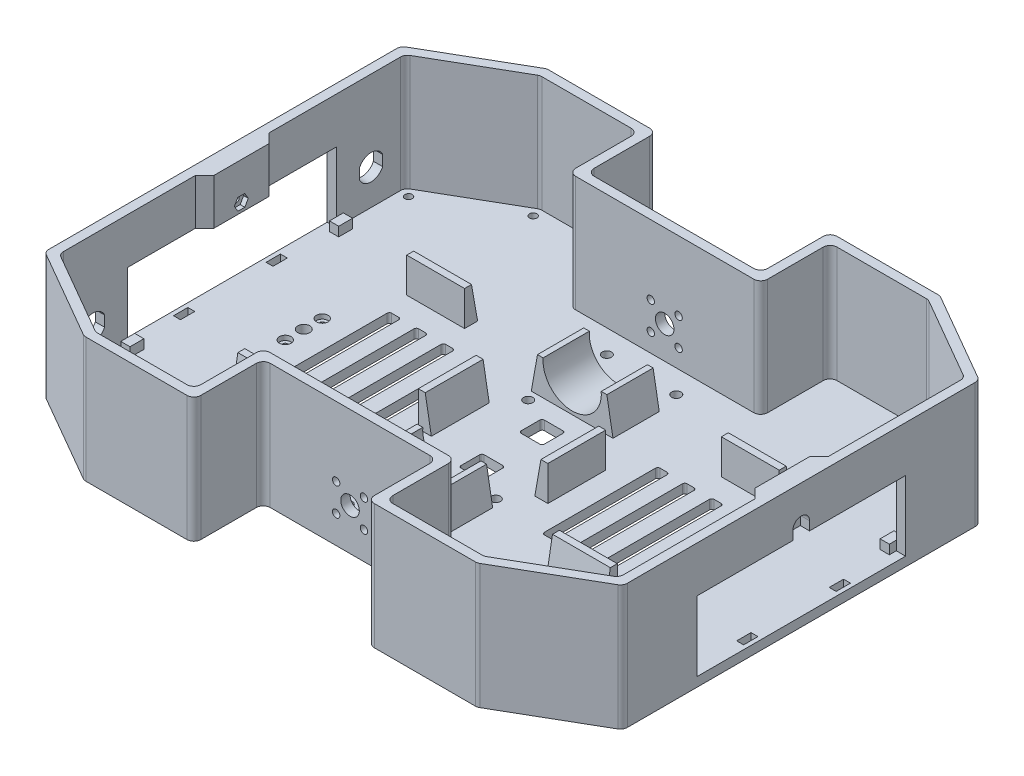
from build123d import *
from OCP.BRepFilletAPI import BRepFilletAPI_MakeChamfer

# Parameters (mm, degrees)
BOSS_EXTRUDE1_DEPTH        = 54
SHELL1_T                   = -4
CUT_EXTRUDE4_REACH         = 170.941
SKETCH7_W                  = 75
SKETCH7_H                  = 30
BOSS_EXTRUDE3_DEPTH        = 50
SKETCH9_R                  = 4
SKETCH9_R_2                = 1.6
CUT_EXTRUDE5_DEPTH         = 4
SKETCH10_W                 = 30
SKETCH10_H                 = 20
BOSS_EXTRUDE4_DEPTH        = 15
SKETCH11_R                 = 12.6
CUT_EXTRUDE6_DEPTH         = 20
SKETCH12_W                 = 10
SKETCH12_H                 = 10
CUT_EXTRUDE7_DEPTH         = 168.705098312
FILLET1_R                  = 1
CHAMFER1_SIZE              = 2.644904711
CHAMFER1_SIZE_2            = 15
CUT_EXTRUDE22_REACH        = 169.705
SKETCH36_R                 = 2
FILLET1_OF_MIRROR2_R       = 1
CHAMFER1_OF_MIRROR2_SIZE   = 2.644904711
CHAMFER1_OF_MIRROR2_SIZE_2 = 15
SKETCH13_R                 = 2.6
SKETCH13_R_2               = 1.1
CUT_EXTRUDE8_DEPTH         = 10
SKETCH14_R                 = 2.5
CUT_EXTRUDE9_DEPTH         = 2
SKETCH16_W                 = 90.2
SKETCH16_H                 = 30.2
CUT_EXTRUDE10_DEPTH        = 4.2
CUT_EXTRUDE12_REACH        = 169.705
SKETCH19_W                 = 3
SKETCH19_H                 = 6.2
CUT_EXTRUDE17_REACH        = 276.62
SKETCH27_W                 = 19.8
SKETCH27_H                 = 19.8
BOSS_EXTRUDE6_DEPTH        = 4
CUT_EXTRUDE18_DEPTH        = 2
CUT_EXTRUDE19_REACH        = 272.983
SKETCH29_R                 = 1.1
SKETCH30_W                 = 4
SKETCH30_H                 = 6
BOSS_EXTRUDE7_DEPTH        = 4
CHAMFER3_SIZE              = 6
SKETCH33_W                 = 3
SKETCH33_H                 = 25
SKETCH33_W_2               = 25
SKETCH33_H_2               = 3
BOSS_EXTRUDE9_DEPTH        = 15
CHAMFER8_SIZE              = 2.644904711
CHAMFER8_SIZE_2            = 15
CUT_EXTRUDE21_REACH        = 276.62
FILLET2_R                  = 3
FILLET3_R                  = 3
SKETCH37_R                 = 1.6
CUT_EXTRUDE23_DEPTH        = 168.705098312
CUT_EXTRUDE24_DEPTH        = 168.705098312


# Some blends are built 0.0001 mm under size
with BuildPart() as part:
    # Sketch1 → Boss-Extrude1 (new body)
    with BuildSketch(Plane(origin=(0, 0, 0), x_dir=(1, 0, 0), z_dir=(0, 1, 0))):
        Polygon((-85, 100), (85, 100), (125, 76.905989232), (125, -76.905989232), (85, -100), (-85, -100), (-125, -76.905989232), (-125, 76.905989232), align=None)
    extrude(amount=BOSS_EXTRUDE1_DEPTH)

    # Shell1
    shell1_openings = [part.faces().sort_by_distance(p)[0] for p in [
        (0, 54, 0),
    ]]
    offset(amount=SHELL1_T, openings=shell1_openings, kind=Kind.INTERSECTION)

    # Sketch7 → Cut-Extrude4 (cut, up to next)
    with BuildSketch(Plane(origin=(0, 54, 0), x_dir=(1, 0, 0), z_dir=(0, 1, 0)), mode=Mode.PRIVATE) as cut_extrude4_sk1:
        with Locations((0, -85)):
            Rectangle(SKETCH7_W, SKETCH7_H)
    cut_extrude4_tool1 = extrude(cut_extrude4_sk1.sketch, amount=-CUT_EXTRUDE4_REACH, mode=Mode.PRIVATE) & part.part
    cut_extrude4 = cut_extrude4_tool1.solids().sort_by_distance((0, 54, 85))[0]
    add(cut_extrude4, mode=Mode.SUBTRACT)

    # Sketch8 → Boss-Extrude3 (add)
    with BuildSketch(Plane(origin=(0, 4, 0), x_dir=(1, 0, 0), z_dir=(0, 1, 0))):
        Polygon((-37.5, -96), (-37.5, -70), (37.5, -70), (37.5, -96), (41.5, -96), (41.5, -66), (-41.5, -66), (-41.5, -96), align=None)
    boss_extrude3 = extrude(amount=BOSS_EXTRUDE3_DEPTH)

    # Sketch9 → Cut-Extrude5 (cut)
    with BuildSketch(Plane.XY.offset(70)):
        with Locations((0, 18)):
            Circle(SKETCH9_R)
        with Locations((-6.01040764, 11.98959236)):
            Circle(SKETCH9_R_2)
        with Locations((-6.01040764, 24.01040764)):
            Circle(SKETCH9_R_2)
        with Locations((6.01040764, 24.01040764)):
            Circle(SKETCH9_R_2)
        with Locations((6.01040764, 11.98959236)):
            Circle(SKETCH9_R_2)
    cut_extrude5 = extrude(amount=-CUT_EXTRUDE5_DEPTH, mode=Mode.SUBTRACT)

    # Sketch10 → Boss-Extrude4 (add)
    with BuildSketch(Plane(origin=(0, 4, 0), x_dir=(1, 0, 0), z_dir=(0, 1, 0))):
        with Locations((0, -36)):
            Rectangle(SKETCH10_W, SKETCH10_H)
    boss_extrude4 = extrude(amount=BOSS_EXTRUDE4_DEPTH)

    # Sketch11 → Cut-Extrude6 (cut)
    with BuildSketch(Plane.XY.offset(46)):
        with Locations((0, 18)):
            Circle(SKETCH11_R)
    cut_extrude6 = extrude(amount=-CUT_EXTRUDE6_DEPTH, mode=Mode.SUBTRACT)

    # Sketch12 → Cut-Extrude7 (cut, through all)
    with BuildSketch(Plane(origin=(0, 4, 0), x_dir=(1, 0, 0), z_dir=(0, 1, 0))):
        with Locations((0, -13)):
            Rectangle(SKETCH12_W, SKETCH12_H)
    cut_extrude7 = extrude(amount=-CUT_EXTRUDE7_DEPTH, mode=Mode.SUBTRACT)

    # Fillet1
    fillet1_edges = [part.edges().sort_by_distance(p)[0] for p in [
        (-5, 2, 18),
        (-5, 2, 8),
        (5, 2, 8),
        (5, 2, 18),
    ]]
    fillet(fillet1_edges, radius=FILLET1_R)

    # Chamfer1
    chamfer1_edges_1 = [part.edges().sort_by_distance(p)[0] for p in [
        (-15, 4, 36),
    ]]
    chamfer1_side_1 = [part.faces().sort_by_distance(p)[0] for p in [
        (-15.052898094, 4, 36),
    ]]
    chamfer1_edges_2 = [part.edges().sort_by_distance(p)[0] for p in [
        (15, 4, 36),
    ]]
    chamfer1_side_2 = [part.faces().sort_by_distance(p)[0] for p in [
        (15.052898094, 4, 36),
    ]]
    chamfer1 = BRepFilletAPI_MakeChamfer(part.part.solid().wrapped)
    for e in chamfer1_edges_1:
        chamfer1.Add(CHAMFER1_SIZE - 0.0001, CHAMFER1_SIZE_2 - 0.0001, e.wrapped, chamfer1_side_1[0].wrapped)
    for e in chamfer1_edges_2:
        chamfer1.Add(CHAMFER1_SIZE - 0.0001, CHAMFER1_SIZE_2 - 0.0001, e.wrapped, chamfer1_side_2[0].wrapped)
    add(Compound.cast(chamfer1.Shape()), mode=Mode.REPLACE)  # a hair under: the kernel refuses the full size

    # Sketch36 → Cut-Extrude22 (cut, up to next)
    with BuildSketch(Plane(origin=(0, 4, 0), x_dir=(1, 0, 0), z_dir=(0, 1, 0)), mode=Mode.PRIVATE) as cut_extrude22_sk1:
        with Locations(Location((15, -56, 0), (0, 0, 270))):
            Circle(SKETCH36_R)
    cut_extrude22_tool1 = extrude(cut_extrude22_sk1.sketch, amount=-CUT_EXTRUDE22_REACH, mode=Mode.PRIVATE) & part.part
    # Sketch36 → Cut-Extrude22 (cut, up to next)
    with BuildSketch(Plane(origin=(0, 4, 0), x_dir=(1, 0, 0), z_dir=(0, 1, 0)), mode=Mode.PRIVATE) as cut_extrude22_sk2:
        with Locations(Location((-15, -56, 0), (0, 0, 270))):
            Circle(SKETCH36_R)
    cut_extrude22_tool2 = extrude(cut_extrude22_sk2.sketch, amount=-CUT_EXTRUDE22_REACH, mode=Mode.PRIVATE) & part.part
    # Sketch36 → Cut-Extrude22 (cut, up to next)
    with BuildSketch(Plane(origin=(0, 4, 0), x_dir=(1, 0, 0), z_dir=(0, 1, 0)), mode=Mode.PRIVATE) as cut_extrude22_sk3:
        with Locations(Location((-15, -22, 0), (0, 0, 270))):
            Circle(SKETCH36_R)
    cut_extrude22_tool3 = extrude(cut_extrude22_sk3.sketch, amount=-CUT_EXTRUDE22_REACH, mode=Mode.PRIVATE) & part.part
    # Sketch36 → Cut-Extrude22 (cut, up to next)
    with BuildSketch(Plane(origin=(0, 4, 0), x_dir=(1, 0, 0), z_dir=(0, 1, 0)), mode=Mode.PRIVATE) as cut_extrude22_sk4:
        with Locations(Location((15, -22, 0), (0, 0, 270))):
            Circle(SKETCH36_R)
    cut_extrude22_tool4 = extrude(cut_extrude22_sk4.sketch, amount=-CUT_EXTRUDE22_REACH, mode=Mode.PRIVATE) & part.part
    cut_extrude22_1 = cut_extrude22_tool1.solids().sort_by_distance((15, 4, 56))[0]
    add(cut_extrude22_1, mode=Mode.SUBTRACT)
    cut_extrude22_2 = cut_extrude22_tool2.solids().sort_by_distance((-15, 4, 56))[0]
    add(cut_extrude22_2, mode=Mode.SUBTRACT)
    cut_extrude22_3 = cut_extrude22_tool3.solids().sort_by_distance((-15, 4, 22))[0]
    add(cut_extrude22_3, mode=Mode.SUBTRACT)
    cut_extrude22_4 = cut_extrude22_tool4.solids().sort_by_distance((15, 4, 22))[0]
    add(cut_extrude22_4, mode=Mode.SUBTRACT)
    cut_extrude22 = cut_extrude22_1 + cut_extrude22_2 + cut_extrude22_3 + cut_extrude22_4  # Cut-Extrude22 as one shape, for the pattern or mirror that repeats it

    # Mirror2: Cut-Extrude4, Boss-Extrude3, Cut-Extrude5, Boss-Extrude4, Cut-Extrude6, Cut-Extrude7, Cut-Extrude22 across plane
    add(cut_extrude4.mirror(Plane.XY), mode=Mode.SUBTRACT)
    add(boss_extrude3.mirror(Plane.XY))
    add(cut_extrude5.mirror(Plane.XY), mode=Mode.SUBTRACT)
    add(boss_extrude4.mirror(Plane.XY))
    add(cut_extrude6.mirror(Plane.XY), mode=Mode.SUBTRACT)
    add(cut_extrude7.mirror(Plane.XY), mode=Mode.SUBTRACT)
    add(cut_extrude22.mirror(Plane.XY), mode=Mode.SUBTRACT)

    # Fillet1 of Mirror2
    fillet1_of_mirror2_edges = [part.edges().sort_by_distance(p)[0] for p in [
        (-5, 2, -18),
        (-5, 2, -8),
        (5, 2, -8),
        (5, 2, -18),
    ]]
    fillet(fillet1_of_mirror2_edges, radius=FILLET1_OF_MIRROR2_R)

    # Chamfer1 of Mirror2
    chamfer1_of_mirror2_edges_1 = [part.edges().sort_by_distance(p)[0] for p in [
        (-15, 4, -36),
    ]]
    chamfer1_of_mirror2_side_1 = [part.faces().sort_by_distance(p)[0] for p in [
        (-15.052898094, 4, -36),
    ]]
    chamfer1_of_mirror2_edges_2 = [part.edges().sort_by_distance(p)[0] for p in [
        (15, 4, -36),
    ]]
    chamfer1_of_mirror2_side_2 = [part.faces().sort_by_distance(p)[0] for p in [
        (15.052898094, 4, -36),
    ]]
    chamfer1_of_mirror2 = BRepFilletAPI_MakeChamfer(part.part.solid().wrapped)
    for e in chamfer1_of_mirror2_edges_1:
        chamfer1_of_mirror2.Add(CHAMFER1_OF_MIRROR2_SIZE - 0.0001, CHAMFER1_OF_MIRROR2_SIZE_2 - 0.0001, e.wrapped, chamfer1_of_mirror2_side_1[0].wrapped)
    for e in chamfer1_of_mirror2_edges_2:
        chamfer1_of_mirror2.Add(CHAMFER1_OF_MIRROR2_SIZE - 0.0001, CHAMFER1_OF_MIRROR2_SIZE_2 - 0.0001, e.wrapped, chamfer1_of_mirror2_side_2[0].wrapped)
    add(Compound.cast(chamfer1_of_mirror2.Shape()), mode=Mode.REPLACE)  # a hair under: the kernel refuses the full size

    # Sketch13 → Cut-Extrude8 (cut)
    with BuildSketch(Plane(origin=(0, 4, 0), x_dir=(1, 0, 0), z_dir=(0, 1, 0))):
        with Locations(Location((-90, 0, 0), (0, 0, 270))):
            Circle(SKETCH13_R)
        with Locations(Location((90, 0, 0), (0, 0, 270))):
            Circle(SKETCH13_R)
        with Locations(Location((-90.000478025, -7.999999986, 0), (0, 0, 270))):
            Circle(SKETCH13_R_2)
        with Locations(Location((-89.999521975, 7.999999986, 0), (0, 0, 270))):
            Circle(SKETCH13_R_2)
        with Locations(Location((89.999521975, -7.999999986, 0), (0, 0, 270))):
            Circle(SKETCH13_R_2)
        with Locations(Location((90.000478025, 7.999999986, 0), (0, 0, 270))):
            Circle(SKETCH13_R_2)
    extrude(amount=-CUT_EXTRUDE8_DEPTH, mode=Mode.SUBTRACT)

    # Sketch14 → Cut-Extrude9 (cut)
    with BuildSketch(Plane(origin=(0, 4, 0), x_dir=(1, 0, 0), z_dir=(0, 1, 0))):
        with Locations(Location((-89.999521975, 7.999999986, 0), (0, 0, 270))):
            Circle(SKETCH14_R)
        with Locations(Location((-90.000478025, -7.999999986, 0), (0, 0, 270))):
            Circle(SKETCH14_R)
        with Locations(Location((90.000478025, 7.999999986, 0), (0, 0, 270))):
            Circle(SKETCH14_R)
        with Locations(Location((89.999521975, -7.999999986, 0), (0, 0, 270))):
            Circle(SKETCH14_R)
    extrude(amount=-CUT_EXTRUDE9_DEPTH, mode=Mode.SUBTRACT)

    # Sketch16 → Cut-Extrude10 (cut)
    with BuildSketch(Plane.ZY.offset(125)):
        with Locations((0, 19.1)):
            Rectangle(SKETCH16_W, SKETCH16_H)
    cut_extrude10 = extrude(amount=-CUT_EXTRUDE10_DEPTH, mode=Mode.SUBTRACT)

    # Sketch19 → Cut-Extrude12 (cut, up to next)
    with BuildSketch(Plane(origin=(0, 4, 0), x_dir=(1, 0, 0), z_dir=(0, 1, 0)), mode=Mode.PRIVATE) as cut_extrude12_sk1:
        with Locations((-121.7, 20)):
            Rectangle(SKETCH19_W, SKETCH19_H)
    cut_extrude12_tool1 = extrude(cut_extrude12_sk1.sketch, amount=-CUT_EXTRUDE12_REACH, mode=Mode.PRIVATE) & part.part
    # Sketch19 → Cut-Extrude12 (cut, up to next)
    with BuildSketch(Plane(origin=(0, 4, 0), x_dir=(1, 0, 0), z_dir=(0, 1, 0)), mode=Mode.PRIVATE) as cut_extrude12_sk2:
        with Locations((-121.7, -20)):
            Rectangle(SKETCH19_W, SKETCH19_H)
    cut_extrude12_tool2 = extrude(cut_extrude12_sk2.sketch, amount=-CUT_EXTRUDE12_REACH, mode=Mode.PRIVATE) & part.part
    cut_extrude12_1 = cut_extrude12_tool1.solids().sort_by_distance((-121.7, 4, -20))[0]
    add(cut_extrude12_1, mode=Mode.SUBTRACT)
    cut_extrude12_2 = cut_extrude12_tool2.solids().sort_by_distance((-121.7, 4, 20))[0]
    add(cut_extrude12_2, mode=Mode.SUBTRACT)
    cut_extrude12 = cut_extrude12_1 + cut_extrude12_2  # Cut-Extrude12 as one shape, for the pattern or mirror that repeats it

    # Sketch26 → Cut-Extrude17 (cut, up to next)
    with BuildSketch(Plane.ZY.offset(125), mode=Mode.PRIVATE) as cut_extrude17_sk1:
        with BuildLine():
            ThreePointArc((3.6, 38), (0, 41.6), (-3.6, 38))
            Line((-3.6, 38), (3.6, 38))
        make_face()
    cut_extrude17_tool1 = extrude(cut_extrude17_sk1.sketch, amount=-CUT_EXTRUDE17_REACH, mode=Mode.PRIVATE) & part.part
    # Sketch26 → Cut-Extrude17 (cut, up to next)
    with BuildSketch(Plane.ZY.offset(125), mode=Mode.PRIVATE) as cut_extrude17_sk2:
        with BuildLine():
            Line((3.6, 38), (-3.6, 38))
            ThreePointArc((-3.6, 38), (0, 34.4), (3.6, 38))
        make_face()
    cut_extrude17_tool2 = extrude(cut_extrude17_sk2.sketch, amount=-CUT_EXTRUDE17_REACH, mode=Mode.PRIVATE) & part.part
    # Sketch26 → Cut-Extrude17 (cut, up to next)
    with BuildSketch(Plane.ZY.offset(125), mode=Mode.PRIVATE) as cut_extrude17_sk3:
        with BuildLine():
            ThreePointArc((3.6, 38), (0, 41.6), (-3.6, 38))
            Line((-3.6, 38), (3.6, 38))
        make_face()
    cut_extrude17_tool3 = extrude(cut_extrude17_sk3.sketch, amount=-CUT_EXTRUDE17_REACH, mode=Mode.PRIVATE) & part.part
    # Sketch26 → Cut-Extrude17 (cut, up to next)
    with BuildSketch(Plane.ZY.offset(125), mode=Mode.PRIVATE) as cut_extrude17_sk4:
        with BuildLine():
            Line((3.6, 38), (-3.6, 38))
            ThreePointArc((-3.6, 38), (0, 34.4), (3.6, 38))
        make_face()
    cut_extrude17_tool4 = extrude(cut_extrude17_sk4.sketch, amount=-CUT_EXTRUDE17_REACH, mode=Mode.PRIVATE) & part.part
    # Sketch26 → Cut-Extrude17 (cut, up to next)
    with BuildSketch(Plane.ZY.offset(125), mode=Mode.PRIVATE) as cut_extrude17_sk5:
        with BuildLine():
            ThreePointArc((3.6, 38), (0, 34.4), (-3.6, 38))
            Line((-3.6, 38), (-3.6, 34.2))
            Line((-3.6, 34.2), (3.6, 34.2))
            Line((3.6, 34.2), (3.6, 38))
        make_face()
    cut_extrude17_tool5 = extrude(cut_extrude17_sk5.sketch, amount=-CUT_EXTRUDE17_REACH, mode=Mode.PRIVATE) & part.part
    cut_extrude17_1 = cut_extrude17_tool1.solids().sort_by_distance((-125, 39.527887, 0))[0]
    add(cut_extrude17_1, mode=Mode.SUBTRACT)
    cut_extrude17_2 = cut_extrude17_tool2.solids().sort_by_distance((-125, 36.472113, 0))[0]
    add(cut_extrude17_2, mode=Mode.SUBTRACT)
    cut_extrude17_3 = cut_extrude17_tool3.solids().sort_by_distance((-125, 39.527887, 0))[0]
    add(cut_extrude17_3, mode=Mode.SUBTRACT)
    cut_extrude17_4 = cut_extrude17_tool4.solids().sort_by_distance((-125, 36.472113, 0))[0]
    add(cut_extrude17_4, mode=Mode.SUBTRACT)
    cut_extrude17_5 = cut_extrude17_tool5.solids().sort_by_distance((-125, 34.318587, 0))[0]
    add(cut_extrude17_5, mode=Mode.SUBTRACT)
    cut_extrude17 = cut_extrude17_1 + cut_extrude17_2 + cut_extrude17_3 + cut_extrude17_4 + cut_extrude17_5  # Cut-Extrude17 as one shape, for the pattern or mirror that repeats it

    # Sketch27 → Boss-Extrude6 (add)
    with BuildSketch(Plane(origin=(-121, 0, 0), x_dir=(0, 0, -1), z_dir=(1, 0, 0))):
        with Locations((0, 44.1)):
            Rectangle(SKETCH27_W, SKETCH27_H)
    boss_extrude6 = extrude(amount=BOSS_EXTRUDE6_DEPTH)

    # Sketch28 → Cut-Extrude18 (cut)
    with BuildSketch(Plane(origin=(-117, 0, 0), x_dir=(0, 0, -1), z_dir=(1, 0, 0))):
        Polygon((1.5011107, 35.4), (3.0022214, 38), (1.5011107, 40.6), (-1.5011107, 40.6), (-3.0022214, 38), (-1.5011107, 35.4), align=None)
    cut_extrude18 = extrude(amount=-CUT_EXTRUDE18_DEPTH, mode=Mode.SUBTRACT)

    # Sketch29 → Cut-Extrude19 (cut, up to next)
    with BuildSketch(Plane.ZY.offset(121), mode=Mode.PRIVATE) as cut_extrude19_sk1:
        with Locations((0, 38)):
            Circle(SKETCH29_R)
    cut_extrude19_tool1 = extrude(cut_extrude19_sk1.sketch, amount=-CUT_EXTRUDE19_REACH, mode=Mode.PRIVATE) & part.part
    cut_extrude19 = cut_extrude19_tool1.solids().sort_by_distance((-121, 38, 0))[0]
    add(cut_extrude19, mode=Mode.SUBTRACT)

    # Sketch30 → Boss-Extrude7 (add)
    with BuildSketch(Plane(origin=(0, 4, 0), x_dir=(1, 0, 0), z_dir=(0, 1, 0))):
        with Locations((-119, 45.1)):
            Rectangle(SKETCH30_W, SKETCH30_H)
        with Locations((-119, -45.1)):
            Rectangle(SKETCH30_W, SKETCH30_H)
    boss_extrude7 = extrude(amount=BOSS_EXTRUDE7_DEPTH)

    # Mirror4: Cut-Extrude10, Cut-Extrude12, Cut-Extrude17, Boss-Extrude6, Cut-Extrude18, Cut-Extrude19, Boss-Extrude7 across plane
    add(cut_extrude10.mirror(Plane(origin=(0, 0, 0), x_dir=(0, 0, 1), z_dir=(1, 0, 0))), mode=Mode.SUBTRACT)
    add(cut_extrude12.mirror(Plane(origin=(0, 0, 0), x_dir=(0, 0, 1), z_dir=(1, 0, 0))), mode=Mode.SUBTRACT)
    add(cut_extrude17.mirror(Plane(origin=(0, 0, 0), x_dir=(0, 0, 1), z_dir=(1, 0, 0))), mode=Mode.SUBTRACT)
    add(boss_extrude6.mirror(Plane(origin=(0, 0, 0), x_dir=(0, 0, 1), z_dir=(1, 0, 0))))
    add(cut_extrude18.mirror(Plane(origin=(0, 0, 0), x_dir=(0, 0, 1), z_dir=(1, 0, 0))), mode=Mode.SUBTRACT)
    add(cut_extrude19.mirror(Plane(origin=(0, 0, 0), x_dir=(0, 0, 1), z_dir=(1, 0, 0))), mode=Mode.SUBTRACT)
    add(boss_extrude7.mirror(Plane(origin=(0, 0, 0), x_dir=(0, 0, 1), z_dir=(1, 0, 0))))

    # Chamfer3
    # the kernel refuses this chamfer: 6 mm, written as the material it adds along each edge
    with BuildSketch(Plane(origin=(-121, 34.2, 9.9), x_dir=(-0.027495876610586768, 0, 0.9996219169112968), z_dir=(0, 1, 0))) as chamfer3_piece_1_section:
        Polygon((CHAMFER3_SIZE * 0.999621916911, CHAMFER3_SIZE * 0.0274958766106), (-CHAMFER3_SIZE * 0.0274958766106, CHAMFER3_SIZE * 0.999621916911), (0, 0), align=None)
    chamfer3_piece_1 = extrude(amount=19.8, mode=Mode.PRIVATE)
    chamfer3_piece_1 = split(chamfer3_piece_1, bisect_by=Plane(origin=(-117, 44.1, 12.08418201), z_dir=(-1, 0, 0)), keep=Keep.TOP, mode=Mode.PRIVATE)
    add(chamfer3_piece_1)
    with BuildSketch(Plane(origin=(-121, 54, -9.9), x_dir=(-0.027495876610586768, 0, -0.9996219169112968), z_dir=(0, -1, 0))) as chamfer3_piece_2_section:
        Polygon((CHAMFER3_SIZE * 0.999621916911, CHAMFER3_SIZE * 0.0274958766106), (-CHAMFER3_SIZE * 0.0274958766106, CHAMFER3_SIZE * 0.999621916911), (0, 0), align=None)
    chamfer3_piece_2 = extrude(amount=19.8, mode=Mode.PRIVATE)
    chamfer3_piece_2 = split(chamfer3_piece_2, bisect_by=Plane(origin=(-117, 44.1, -12.08418201), z_dir=(-1, 0, 0)), keep=Keep.TOP, mode=Mode.PRIVATE)
    add(chamfer3_piece_2)
    with BuildSketch(Plane(origin=(121, 34.2, 9.9), x_dir=(0.02749587661060977, 0, 0.999621916911296), z_dir=(0, 1, 0))) as chamfer3_piece_3_section:
        Polygon((CHAMFER3_SIZE * 0.999621916911, -CHAMFER3_SIZE * 0.0274958766106), (-CHAMFER3_SIZE * 0.0274958766106, -CHAMFER3_SIZE * 0.999621916911), (0, 0), align=None)
    chamfer3_piece_3 = extrude(amount=19.8, mode=Mode.PRIVATE)
    chamfer3_piece_3 = split(chamfer3_piece_3, bisect_by=Plane(origin=(117, 44.1, 12.08418201), z_dir=(1, 0, 0)), keep=Keep.TOP, mode=Mode.PRIVATE)
    add(chamfer3_piece_3)
    with BuildSketch(Plane(origin=(121, 54, -9.9), x_dir=(0.0274958766106098, 0, -0.999621916911296), z_dir=(0, -1, 0))) as chamfer3_piece_4_section:
        Polygon((CHAMFER3_SIZE * 0.999621916911, -CHAMFER3_SIZE * 0.0274958766106), (-CHAMFER3_SIZE * 0.0274958766106, -CHAMFER3_SIZE * 0.999621916911), (0, 0), align=None)
    chamfer3_piece_4 = extrude(amount=19.8, mode=Mode.PRIVATE)
    chamfer3_piece_4 = split(chamfer3_piece_4, bisect_by=Plane(origin=(117, 44.1, -12.08418201), z_dir=(1, 0, 0)), keep=Keep.TOP, mode=Mode.PRIVATE)
    add(chamfer3_piece_4)

    # Sketch33 → Boss-Extrude9 (add)
    with BuildSketch(Plane(origin=(0, 4, 0), x_dir=(1, 0, 0), z_dir=(0, 1, 0))):
        with Locations((-26.5, 0)):
            Rectangle(SKETCH33_W, SKETCH33_H)
        with Locations((-68, 36.5)):
            Rectangle(SKETCH33_W_2, SKETCH33_H_2)
        with Locations((-68, -36.5)):
            Rectangle(SKETCH33_W_2, SKETCH33_H_2)
        with Locations((68, -36.5)):
            Rectangle(SKETCH33_W_2, SKETCH33_H_2)
        with Locations((26.5, 0)):
            Rectangle(SKETCH33_W, SKETCH33_H)
        with Locations((68, 36.5)):
            Rectangle(SKETCH33_W_2, SKETCH33_H_2)
    extrude(amount=BOSS_EXTRUDE9_DEPTH)

    # Chamfer8
    chamfer8_edges_1 = [part.edges().sort_by_distance(p)[0] for p in [
        (-68, 4, 38),
    ]]
    chamfer8_side_1 = [part.faces().sort_by_distance(p)[0] for p in [
        (-68, 4, 38.052898094),
    ]]
    chamfer8_edges_2 = [part.edges().sort_by_distance(p)[0] for p in [
        (-25, 4, 0),
    ]]
    chamfer8_side_2 = [part.faces().sort_by_distance(p)[0] for p in [
        (-24.947101906, 4, 0),
    ]]
    chamfer8_edges_3 = [part.edges().sort_by_distance(p)[0] for p in [
        (-68, 4, -38),
    ]]
    chamfer8_side_3 = [part.faces().sort_by_distance(p)[0] for p in [
        (-68, 4, -38.052898094),
    ]]
    chamfer8_edges_4 = [part.edges().sort_by_distance(p)[0] for p in [
        (68, 4, -38),
    ]]
    chamfer8_side_4 = [part.faces().sort_by_distance(p)[0] for p in [
        (68, 4, -38.052898094),
    ]]
    chamfer8_edges_5 = [part.edges().sort_by_distance(p)[0] for p in [
        (25, 4, 0),
    ]]
    chamfer8_side_5 = [part.faces().sort_by_distance(p)[0] for p in [
        (24.947101906, 4, 0),
    ]]
    chamfer8_edges_6 = [part.edges().sort_by_distance(p)[0] for p in [
        (68, 4, 38),
    ]]
    chamfer8_side_6 = [part.faces().sort_by_distance(p)[0] for p in [
        (68, 4, 38.052898094),
    ]]
    chamfer8 = BRepFilletAPI_MakeChamfer(part.part.solid().wrapped)
    for e in chamfer8_edges_1:
        chamfer8.Add(CHAMFER8_SIZE - 0.0001, CHAMFER8_SIZE_2 - 0.0001, e.wrapped, chamfer8_side_1[0].wrapped)
    for e in chamfer8_edges_2:
        chamfer8.Add(CHAMFER8_SIZE - 0.0001, CHAMFER8_SIZE_2 - 0.0001, e.wrapped, chamfer8_side_2[0].wrapped)
    for e in chamfer8_edges_3:
        chamfer8.Add(CHAMFER8_SIZE - 0.0001, CHAMFER8_SIZE_2 - 0.0001, e.wrapped, chamfer8_side_3[0].wrapped)
    for e in chamfer8_edges_4:
        chamfer8.Add(CHAMFER8_SIZE - 0.0001, CHAMFER8_SIZE_2 - 0.0001, e.wrapped, chamfer8_side_4[0].wrapped)
    for e in chamfer8_edges_5:
        chamfer8.Add(CHAMFER8_SIZE - 0.0001, CHAMFER8_SIZE_2 - 0.0001, e.wrapped, chamfer8_side_5[0].wrapped)
    for e in chamfer8_edges_6:
        chamfer8.Add(CHAMFER8_SIZE - 0.0001, CHAMFER8_SIZE_2 - 0.0001, e.wrapped, chamfer8_side_6[0].wrapped)
    add(Compound.cast(chamfer8.Shape()), mode=Mode.REPLACE)  # a hair under: the kernel refuses the full size

    # Sketch34 → Cut-Extrude21 (cut, up to next)
    with BuildSketch(Plane.ZY.offset(125), mode=Mode.PRIVATE) as cut_extrude21_sk1:
        with BuildLine():
            ThreePointArc((-55.1, 21.391287847), (-60.1, 24.6), (-65.1, 21.391287847))
            Line((-65.1, 21.391287847), (-65.1, 16.808712153))
            ThreePointArc((-65.1, 16.808712153), (-60.1, 13.6), (-55.1, 16.808712153))
            Line((-55.1, 16.808712153), (-55.1, 21.391287847))
        make_face()
    cut_extrude21_tool1 = extrude(cut_extrude21_sk1.sketch, amount=-CUT_EXTRUDE21_REACH, mode=Mode.PRIVATE) & part.part
    # Sketch34 → Cut-Extrude21 (cut, up to next)
    with BuildSketch(Plane.ZY.offset(125), mode=Mode.PRIVATE) as cut_extrude21_sk2:
        with BuildLine():
            ThreePointArc((65.1, 21.391287847), (60.1, 24.6), (55.1, 21.391287847))
            Line((55.1, 21.391287847), (55.1, 16.808712153))
            ThreePointArc((55.1, 16.808712153), (60.1, 13.6), (65.1, 16.808712153))
            Line((65.1, 16.808712153), (65.1, 21.391287847))
        make_face()
    cut_extrude21_tool2 = extrude(cut_extrude21_sk2.sketch, amount=-CUT_EXTRUDE21_REACH, mode=Mode.PRIVATE) & part.part
    add(cut_extrude21_tool1.solids().sort_by_distance((-125, 19.1, -60.1))[0], mode=Mode.SUBTRACT)
    add(cut_extrude21_tool2.solids().sort_by_distance((-125, 19.1, 60.1))[0], mode=Mode.SUBTRACT)

    # Fillet2
    fillet2_edges = [part.edges().sort_by_distance(p)[0] for p in [
        (-85, 27, -100),
        (85, 27, -100),
        (125, 27, -76.905989232),
        (125, 27, 76.905989232),
        (85, 27, 100),
        (-85, 27, 100),
        (-125, 27, 76.905989232),
        (-125, 27, -76.905989232),
        (-37.5, 27, -70),
        (37.5, 27, -100),
        (37.5, 27, -70),
        (-37.5, 27, -100),
        (-37.5, 27, 70),
        (-37.5, 27, 100),
        (37.5, 27, 70),
        (37.5, 27, 100),
    ]]
    fillet(fillet2_edges, radius=FILLET2_R)

    # Fillet3
    fillet3_edges = [part.edges().sort_by_distance(p)[0] for p in [
        (-41.5, 29, -96),
        (-41.5, 29, -66),
        (41.5, 29, -66),
        (41.5, 29, -96),
        (-83.92820323, 29, -96),
        (-121, 29, -74.596588156),
        (-121, 29, 74.596588156),
        (-83.92820323, 29, 96),
        (83.92820323, 29, 96),
        (121, 29, 74.596588156),
        (121, 29, -74.596588156),
        (83.92820323, 29, -96),
        (-41.5, 29, 96),
        (41.5, 29, 96),
        (41.5, 29, 66),
        (-41.5, 29, 66),
    ]]
    fillet(fillet3_edges, radius=FILLET3_R)

    # Sketch37 → Cut-Extrude23 (cut, through all)
    with BuildSketch(Plane(origin=(0, 4, 0), x_dir=(1, 0, 0), z_dir=(0, 1, 0))):
        with Locations(Location((82.856406461, 92, 0), (0, 0, 270))):
            Circle(SKETCH37_R)
        with Locations(Location((117, 72.287187079, 0), (0, 0, 270))):
            Circle(SKETCH37_R)
        with Locations(Location((117, -72.287187079, 0), (0, 0, 90))):
            Circle(SKETCH37_R)
        with Locations(Location((82.856406461, -92, 0), (0, 0, 90))):
            Circle(SKETCH37_R)
        with Locations(Location((-82.856406461, -92, 0), (0, 0, 270))):
            Circle(SKETCH37_R)
        with Locations(Location((-117, -72.287187079, 0), (0, 0, 270))):
            Circle(SKETCH37_R)
        with Locations(Location((-117, 72.287187079, 0), (0, 0, 90))):
            Circle(SKETCH37_R)
        with Locations(Location((-82.856406461, 92, 0), (0, 0, 90))):
            Circle(SKETCH37_R)
    extrude(amount=-CUT_EXTRUDE23_DEPTH, mode=Mode.SUBTRACT)

    # Sketch38 → Cut-Extrude24 (cut, through all)
    with BuildSketch(Plane(origin=(0, 4, 0), x_dir=(1, 0, 0), z_dir=(0, 1, 0))):
        with BuildLine():
            Line((-42, 25), (-39, 25))
            ThreePointArc((-39, 25), (-38.292893219, 24.707106781), (-38, 24))
            Line((-38, 24), (-38, -24))
            ThreePointArc((-38, -24), (-38.292893219, -24.707106781), (-39, -25))
            Line((-39, -25), (-42, -25))
            ThreePointArc((-42, -25), (-42.707106781, -24.707106781), (-43, -24))
            Line((-43, -24), (-43, 24))
            ThreePointArc((-43, 24), (-42.707106781, 24.707106781), (-42, 25))
        make_face()
        with BuildLine():
            Line((-54.666666667, 24), (-54.666666667, -24))
            ThreePointArc((-54.666666667, -24), (-54.373773448, -24.707106781), (-53.666666667, -25))
            Line((-53.666666667, -25), (-50.666666667, -25))
            ThreePointArc((-50.666666667, -25), (-49.959559885, -24.707106781), (-49.666666667, -24))
            Line((-49.666666667, -24), (-49.666666667, 24))
            ThreePointArc((-49.666666667, 24), (-49.959559885, 24.707106781), (-50.666666667, 25))
            Line((-50.666666667, 25), (-53.666666667, 25))
            ThreePointArc((-53.666666667, 25), (-54.373773448, 24.707106781), (-54.666666667, 24))
        make_face()
        with BuildLine():
            Line((-66.333333333, 24), (-66.333333333, -24))
            ThreePointArc((-66.333333333, -24), (-66.040440115, -24.707106781), (-65.333333333, -25))
            Line((-65.333333333, -25), (-62.333333333, -25))
            ThreePointArc((-62.333333333, -25), (-61.626226552, -24.707106781), (-61.333333333, -24))
            Line((-61.333333333, -24), (-61.333333333, 24))
            ThreePointArc((-61.333333333, 24), (-61.626226552, 24.707106781), (-62.333333333, 25))
            Line((-62.333333333, 25), (-65.333333333, 25))
            ThreePointArc((-65.333333333, 25), (-66.040440115, 24.707106781), (-66.333333333, 24))
        make_face()
        with BuildLine():
            Line((-78, 24), (-78, -24))
            ThreePointArc((-78, -24), (-77.707106781, -24.707106781), (-77, -25))
            Line((-77, -25), (-74, -25))
            ThreePointArc((-74, -25), (-73.292893219, -24.707106781), (-73, -24))
            Line((-73, -24), (-73, 24))
            ThreePointArc((-73, 24), (-73.292893219, 24.707106781), (-74, 25))
            Line((-74, 25), (-77, 25))
            ThreePointArc((-77, 25), (-77.707106781, 24.707106781), (-78, 24))
        make_face()
        with BuildLine():
            Line((77, -25), (74, -25))
            ThreePointArc((74, -25), (73.292893219, -24.707106781), (73, -24))
            Line((73, -24), (73, 24))
            ThreePointArc((73, 24), (73.292893219, 24.707106781), (74, 25))
            Line((74, 25), (77, 25))
            ThreePointArc((77, 25), (77.707106781, 24.707106781), (78, 24))
            Line((78, 24), (78, -24))
            ThreePointArc((78, -24), (77.707106781, -24.707106781), (77, -25))
        make_face()
        with BuildLine():
            Line((65.333333333, -25), (62.333333333, -25))
            ThreePointArc((62.333333333, -25), (61.626226552, -24.707106781), (61.333333333, -24))
            Line((61.333333333, -24), (61.333333333, 24))
            ThreePointArc((61.333333333, 24), (61.626226552, 24.707106781), (62.333333333, 25))
            Line((62.333333333, 25), (65.333333333, 25))
            ThreePointArc((65.333333333, 25), (66.040440115, 24.707106781), (66.333333333, 24))
            Line((66.333333333, 24), (66.333333333, -24))
            ThreePointArc((66.333333333, -24), (66.040440115, -24.707106781), (65.333333333, -25))
        make_face()
        with BuildLine():
            Line((53.666666667, -25), (50.666666667, -25))
            ThreePointArc((50.666666667, -25), (49.959559885, -24.707106781), (49.666666667, -24))
            Line((49.666666667, -24), (49.666666667, 24))
            ThreePointArc((49.666666667, 24), (49.959559885, 24.707106781), (50.666666667, 25))
            Line((50.666666667, 25), (53.666666667, 25))
            ThreePointArc((53.666666667, 25), (54.373773448, 24.707106781), (54.666666667, 24))
            Line((54.666666667, 24), (54.666666667, -24))
            ThreePointArc((54.666666667, -24), (54.373773448, -24.707106781), (53.666666667, -25))
        make_face()
        with BuildLine():
            Line((38, 24), (38, -24))
            ThreePointArc((38, -24), (38.292893219, -24.707106781), (39, -25))
            Line((39, -25), (42, -25))
            ThreePointArc((42, -25), (42.707106781, -24.707106781), (43, -24))
            Line((43, -24), (43, 24))
            ThreePointArc((43, 24), (42.707106781, 24.707106781), (42, 25))
            Line((42, 25), (39, 25))
            ThreePointArc((39, 25), (38.292893219, 24.707106781), (38, 24))
        make_face()
    extrude(amount=-CUT_EXTRUDE24_DEPTH, mode=Mode.SUBTRACT)


solid = part.part
